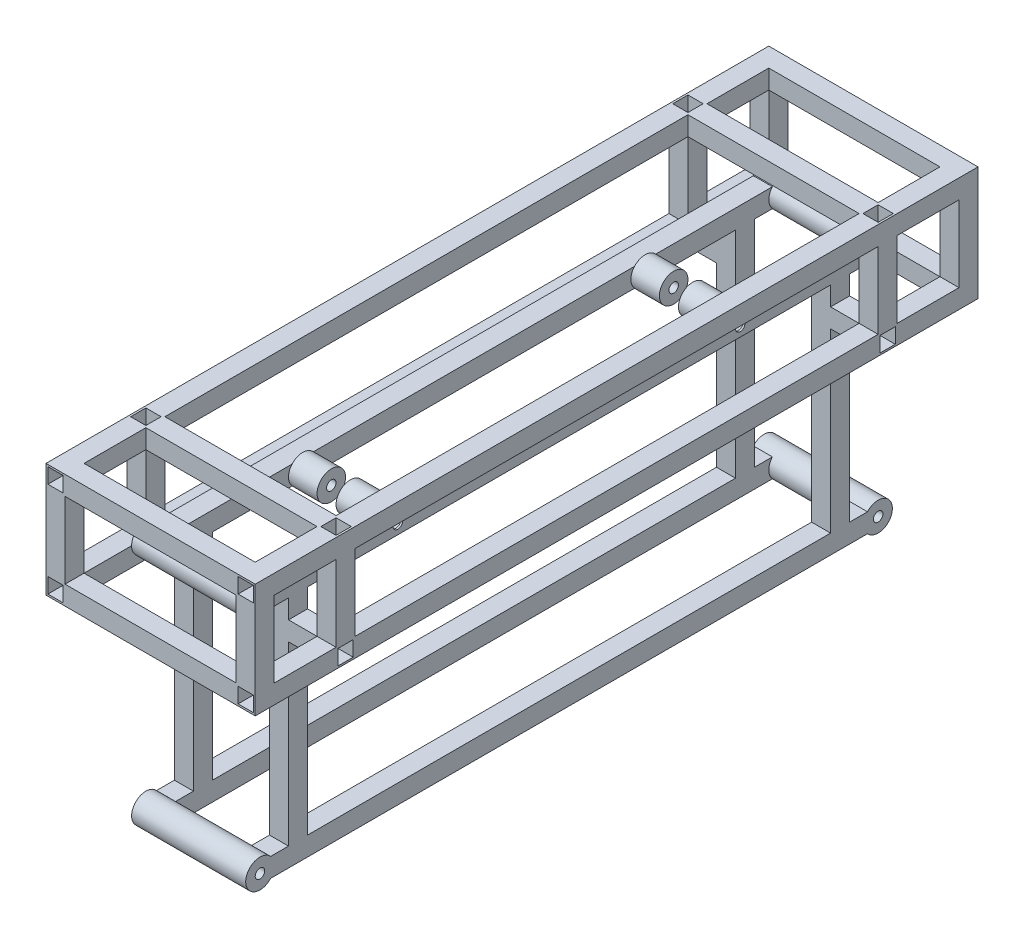
from build123d import *
from build123d.topology import SkipClean

# Parameters (mm, degrees)
SZKIC1_W                      = 20
SZKIC1_H                      = 20
SZKIC1_W_2                    = 16
SZKIC1_H_2                    = 16
DODANIE_WYCI_GNI_CIE1_DEPTH   = 325
DODANIE_WYCI_GNI_CIE1_2_DEPTH = 325
SZKIC3_R                      = 15
DODANIE_WYCI_GNI_CIE2_DEPTH   = 120
SZKIC4_R                      = 5
WYTNIJ_WYCI_GNI_CIE1_DEPTH    = 120
SZKIC5_W                      = 20
SZKIC5_H                      = 20
SZKIC5_W_2                    = 16
SZKIC5_H_2                    = 16
DODANIE_WYCI_GNI_CIE3_DEPTH   = 226
SZKIC6_W                      = 20
SZKIC6_H                      = 20
SZKIC6_W_2                    = 16
SZKIC6_H_2                    = 16
DODANIE_WYCI_GNI_CIE4_DEPTH   = 325
SZKIC7_R                      = 15
DODANIE_WYCI_GNI_CIE5_DEPTH   = 120
SZKIC8_R                      = 5
WYTNIJ_WYCI_GNI_CIE2_DEPTH    = 120
SZKIC15_W                     = 20
SZKIC15_H                     = 20
SZKIC15_W_2                   = 16
SZKIC15_H_2                   = 16
DODANIE_WYCI_GNI_CIE8_DEPTH   = 50
DODANIE_WYCI_GNI_CIE9_REACH   = 679.086
SZKIC16_W                     = 20
SZKIC16_H                     = 20
SZKIC16_W_2                   = 16
SZKIC16_H_2                   = 16
LUSTRO6_COPY_1_SKETCH_W       = 20
LUSTRO6_COPY_1_SKETCH_H       = 20
LUSTRO6_COPY_1_SKETCH_W_2     = 16
LUSTRO6_COPY_1_SKETCH_H_2     = 16
LUSTRO6_COPY_1_DEPTH          = 50
SZKIC17_W                     = 20
SZKIC17_H                     = 20
SZKIC17_W_2                   = 16
SZKIC17_H_2                   = 16
DODANIE_WYCI_GNI_CIE10_DEPTH  = 100
DODANIE_WYCI_GNI_CIE11_REACH  = 711.705
SZKIC19_W                     = 20
SZKIC19_H                     = 20
SZKIC19_W_2                   = 16
SZKIC19_H_2                   = 16
DODANIE_WYCI_GNI_CIE12_REACH  = 507.427
SZKIC20_W                     = 20
SZKIC20_H                     = 20
SZKIC20_W_2                   = 16
SZKIC20_H_2                   = 16
SZKIC22_W                     = 20
SZKIC22_H                     = 20
SZKIC22_W_2                   = 16
SZKIC22_H_2                   = 16
DODANIE_WYCI_GNI_CIE13_DEPTH  = 85
DODANIE_WYCI_GNI_CIE14_REACH  = 535.157
SZKIC23_W                     = 20
SZKIC23_H                     = 20
SZKIC23_W_2                   = 16
SZKIC23_H_2                   = 16
DODANIE_WYCI_GNI_CIE15_REACH  = 518.45
SZKIC24_W                     = 20
SZKIC24_H                     = 20
SZKIC24_W_2                   = 16
SZKIC24_H_2                   = 16
SZKIC25_R                     = 5
WYTNIJ_WYCI_GNI_CIE3_DEPTH    = 120
DODANIE_WYCI_GNI_CIE16_START  = 80
SZKIC26_R                     = 15
SZKIC26_R_2                   = 5
DODANIE_WYCI_GNI_CIE16_DEPTH  = 80
SZKIC11_W                     = 20
SZKIC11_H                     = 300
WYTNIJ_WYCI_GNI_CIE4_DEPTH    = 40
SZKIC14_W                     = 20
SZKIC14_H                     = 300
WYTNIJ_WYCI_GNI_CIE5_DEPTH    = 40


with BuildPart() as part:
    # Szkic1 → Dodanie-wyciągnięcie1 (new, symmetric)
    with BuildSketch(Plane.XY):
        Rectangle(SZKIC1_W, SZKIC1_H)
        Rectangle(SZKIC1_W_2, SZKIC1_H_2, mode=Mode.SUBTRACT)
    extrude(amount=DODANIE_WYCI_GNI_CIE1_DEPTH, both=True)



with BuildPart() as body_2:
    # Szkic1 → Dodanie-wyci_gni_cie1 2 (new, symmetric)
    with BuildSketch(Plane.XY):
        with Locations((-100, 0)):
            Rectangle(SZKIC1_W, SZKIC1_H)
        with Locations((-100, 0)):
            Rectangle(SZKIC1_W_2, SZKIC1_H_2, mode=Mode.SUBTRACT)
    extrude(amount=DODANIE_WYCI_GNI_CIE1_2_DEPTH, both=True)


with BuildPart() as part_1:
    add(part.part)

    add(body_2.part)  # Dodanie-wyciągnięcie2 merges body 2
    # Szkic3 → Dodanie-wyciągnięcie2 (add)
    with BuildSketch(Plane(origin=(10, 0, 0), x_dir=(0, 0, -1), z_dir=(1, 0, 0))):
        with Locations(Location((-325, 0, 0), (0, 0, 41.810314896))):
            Circle(SZKIC3_R)
    dodanie_wyci_gni_cie2 = extrude(amount=-DODANIE_WYCI_GNI_CIE2_DEPTH)

    # Szkic4 → Wytnij-wyciągnięcie1 (cut)
    with BuildSketch(Plane(origin=(10, 0, 0), x_dir=(0, 0, -1), z_dir=(1, 0, 0))):
        with Locations((-325, 0)):
            Circle(SZKIC4_R)
    wytnij_wyci_gni_cie1 = extrude(amount=-WYTNIJ_WYCI_GNI_CIE1_DEPTH, mode=Mode.SUBTRACT)

    # Lustro1: Dodanie-wyciągnięcie2, Wytnij-wyciągnięcie1 across plane
    add(dodanie_wyci_gni_cie2.mirror(Plane.XY))
    add(wytnij_wyci_gni_cie1.mirror(Plane.XY), mode=Mode.SUBTRACT)

    # Szkic5 → Dodanie-wyciągnięcie3 (add)
    # profile 1 of 2: a face of its own
    with BuildSketch(Plane(origin=(0, 10, 0), x_dir=(1, 0, 0), z_dir=(0, 1, 0))):
        with Locations((0, -285)):
            Rectangle(SZKIC5_W, SZKIC5_H)
        with Locations((0, -285)):
            Rectangle(SZKIC5_W_2, SZKIC5_H_2, mode=Mode.SUBTRACT)
    # profile 2 of 2: a face of its own
    with BuildSketch(Plane(origin=(0, 10, 0), x_dir=(1, 0, 0), z_dir=(0, 1, 0))):
        with Locations((-100, -285)):
            Rectangle(SZKIC5_W, SZKIC5_H)
        with Locations((-100, -285)):
            Rectangle(SZKIC5_W_2, SZKIC5_H_2, mode=Mode.SUBTRACT)
    dodanie_wyci_gni_cie3 = extrude(amount=DODANIE_WYCI_GNI_CIE3_DEPTH)

    # Lustro2: Dodanie-wyciągnięcie3 across plane
    add(dodanie_wyci_gni_cie3.mirror(Plane.XY))

    # Szkic6 → Dodanie-wyciągnięcie4 (add, symmetric)
    # profile 1 of 2: a face of its own
    with BuildSketch(Plane.XY):
        with Locations((0, 246)):
            Rectangle(SZKIC6_W, SZKIC6_H)
        with Locations((0, 246)):
            Rectangle(SZKIC6_W_2, SZKIC6_H_2, mode=Mode.SUBTRACT)
    # profile 2 of 2: a face of its own
    with BuildSketch(Plane.XY):
        with Locations((-100, 246)):
            Rectangle(SZKIC6_W, SZKIC6_H)
        with Locations((-100, 246)):
            Rectangle(SZKIC6_W_2, SZKIC6_H_2, mode=Mode.SUBTRACT)
    extrude(amount=DODANIE_WYCI_GNI_CIE4_DEPTH, both=True)

    # Szkic7 → Dodanie-wyciągnięcie5 (add)
    with BuildSketch(Plane(origin=(10, 0, 0), x_dir=(0, 0, -1), z_dir=(1, 0, 0))):
        with Locations(Location((-325, 246, 0), (0, 0, 41.810314896))):
            Circle(SZKIC7_R)
    dodanie_wyci_gni_cie5 = extrude(amount=-DODANIE_WYCI_GNI_CIE5_DEPTH)

    # Szkic8 → Wytnij-wyciągnięcie2 (cut)
    with BuildSketch(Plane(origin=(10, 0, 0), x_dir=(0, 0, -1), z_dir=(1, 0, 0))):
        with Locations((-325, 246)):
            Circle(SZKIC8_R)
    wytnij_wyci_gni_cie2 = extrude(amount=-WYTNIJ_WYCI_GNI_CIE2_DEPTH, mode=Mode.SUBTRACT)

    # Lustro4: Dodanie-wyciągnięcie5, Wytnij-wyciągnięcie2 across plane
    add(dodanie_wyci_gni_cie5.mirror(Plane.XY))
    add(wytnij_wyci_gni_cie2.mirror(Plane.XY), mode=Mode.SUBTRACT)

    # Szkic15 → Dodanie-wyciągnięcie8 (add)
    with BuildSketch(Plane(origin=(10, 0, 0), x_dir=(0, 0, -1), z_dir=(1, 0, 0))):
        with Locations((285, 206)):
            Rectangle(SZKIC15_W, SZKIC15_H)
        with Locations((285, 206)):
            Rectangle(SZKIC15_W_2, SZKIC15_H_2, mode=Mode.SUBTRACT)
    dodanie_wyci_gni_cie8 = extrude(amount=DODANIE_WYCI_GNI_CIE8_DEPTH)

    # Lustro5: Dodanie-wyciągnięcie8 across plane
    add(dodanie_wyci_gni_cie8.mirror(Plane.XY))

    # Szkic16 → Dodanie-wyciągnięcie9 (add, up to next)
    with BuildSketch(Plane.XY.offset(-275), mode=Mode.PRIVATE) as dodanie_wyci_gni_cie9_sk1:
        with Locations((50, 206)):
            Rectangle(SZKIC16_W, SZKIC16_H)
        with Locations((50, 206)):
            Rectangle(SZKIC16_W_2, SZKIC16_H_2, mode=Mode.SUBTRACT)
    dodanie_wyci_gni_cie9_tool1 = extrude(dodanie_wyci_gni_cie9_sk1.sketch, amount=DODANIE_WYCI_GNI_CIE9_REACH, mode=Mode.PRIVATE) - part_1.part
    dodanie_wyci_gni_cie9 = dodanie_wyci_gni_cie9_tool1.solids().sort_by_distance((50, 215.717157, -275))[0]
    add(dodanie_wyci_gni_cie9)

    # Lustro6: Dodanie-wyciągnięcie8, Dodanie-wyciągnięcie9 across plane
    add(dodanie_wyci_gni_cie8.mirror(Plane(origin=(-50, 0, 0), x_dir=(0, 0, 1), z_dir=(1, 0, 0))))
    add(dodanie_wyci_gni_cie9.mirror(Plane(origin=(-50, 0, 0), x_dir=(0, 0, 1), z_dir=(1, 0, 0))))

    # Lustro6 copy 1 sketch → Lustro6 copy 1 (add)
    with BuildSketch(Plane.ZY.offset(110)):
        with Locations((285, 206)):
            Rectangle(LUSTRO6_COPY_1_SKETCH_W, LUSTRO6_COPY_1_SKETCH_H)
        with Locations((285, 206)):
            Rectangle(LUSTRO6_COPY_1_SKETCH_W_2, LUSTRO6_COPY_1_SKETCH_H_2, mode=Mode.SUBTRACT)
    extrude(amount=LUSTRO6_COPY_1_DEPTH)

    # Szkic17 → Dodanie-wyciągnięcie10 (add)
    # profile 1 of 4: a face of its own
    with BuildSketch(Plane(origin=(0, 216, 0), x_dir=(1, 0, 0), z_dir=(0, 1, 0))):
        with Locations((50, 285)):
            Rectangle(SZKIC17_W, SZKIC17_H)
        with Locations((50, 285)):
            Rectangle(SZKIC17_W_2, SZKIC17_H_2, mode=Mode.SUBTRACT)
    # profile 2 of 4: a face of its own
    with BuildSketch(Plane(origin=(0, 216, 0), x_dir=(1, 0, 0), z_dir=(0, 1, 0))):
        with Locations((50, -285)):
            Rectangle(SZKIC17_W, SZKIC17_H)
        with Locations((50, -285)):
            Rectangle(SZKIC17_W_2, SZKIC17_H_2, mode=Mode.SUBTRACT)
    # profile 3 of 4: a face of its own
    with BuildSketch(Plane(origin=(0, 216, 0), x_dir=(1, 0, 0), z_dir=(0, 1, 0))):
        with Locations((-150, 285)):
            Rectangle(SZKIC17_W, SZKIC17_H)
        with Locations((-150, 285)):
            Rectangle(SZKIC17_W_2, SZKIC17_H_2, mode=Mode.SUBTRACT)
    # profile 4 of 4: a face of its own
    with BuildSketch(Plane(origin=(0, 216, 0), x_dir=(1, 0, 0), z_dir=(0, 1, 0))):
        with Locations((-150, -285)):
            Rectangle(SZKIC17_W, SZKIC17_H)
        with Locations((-150, -285)):
            Rectangle(SZKIC17_W_2, SZKIC17_H_2, mode=Mode.SUBTRACT)
    extrude(amount=DODANIE_WYCI_GNI_CIE10_DEPTH)

    # Szkic19 → Dodanie-wyciągnięcie11 (add, up to next)
    with BuildSketch(Plane(origin=(0, 0, 275), x_dir=(-1, 0, 0), z_dir=(0, 0, -1)), mode=Mode.PRIVATE) as dodanie_wyci_gni_cie11_sk1:
        with Locations((150, 306)):
            Rectangle(SZKIC19_W, SZKIC19_H)
        with Locations((150, 306)):
            Rectangle(SZKIC19_W_2, SZKIC19_H_2, mode=Mode.SUBTRACT)
    dodanie_wyci_gni_cie11_tool1 = extrude(dodanie_wyci_gni_cie11_sk1.sketch, amount=DODANIE_WYCI_GNI_CIE11_REACH, mode=Mode.PRIVATE) - part_1.part
    dodanie_wyci_gni_cie11 = dodanie_wyci_gni_cie11_tool1.solids().sort_by_distance((-150, 315.717157, 275))[0]
    add(dodanie_wyci_gni_cie11)

    # Lustro7: Dodanie-wyciągnięcie11 across plane
    add(dodanie_wyci_gni_cie11.mirror(Plane(origin=(-50, 0, 0), x_dir=(0, 0, 1), z_dir=(1, 0, 0))))

    # Szkic20 → Dodanie-wyciągnięcie12 (add, up to next)
    with BuildSketch(Plane(origin=(-140, 0, 0), x_dir=(0, 0, -1), z_dir=(1, 0, 0)), mode=Mode.PRIVATE) as dodanie_wyci_gni_cie12_sk1:
        with Locations((285, 306)):
            Rectangle(SZKIC20_W, SZKIC20_H)
        with Locations((285, 306)):
            Rectangle(SZKIC20_W_2, SZKIC20_H_2, mode=Mode.SUBTRACT)
    dodanie_wyci_gni_cie12_tool1 = extrude(dodanie_wyci_gni_cie12_sk1.sketch, amount=DODANIE_WYCI_GNI_CIE12_REACH, mode=Mode.PRIVATE) - part_1.part
    dodanie_wyci_gni_cie12 = dodanie_wyci_gni_cie12_tool1.solids().sort_by_distance((-140, 315.717157, -285))[0]
    add(dodanie_wyci_gni_cie12)

    # Lustro8: Dodanie-wyciągnięcie12 across plane
    add(dodanie_wyci_gni_cie12.mirror(Plane.XY))

    # Szkic22 → Dodanie-wyciągnięcie13 (add)
    # profile 1 of 4: a face of its own
    with BuildSketch(Plane(origin=(0, 0, -295), x_dir=(-1, 0, 0), z_dir=(0, 0, -1))):
        with Locations((150, 306)):
            Rectangle(SZKIC22_W, SZKIC22_H)
        with Locations((150, 306)):
            Rectangle(SZKIC22_W_2, SZKIC22_H_2, mode=Mode.SUBTRACT)
    # profile 2 of 4: a face of its own
    with BuildSketch(Plane(origin=(0, 0, -295), x_dir=(-1, 0, 0), z_dir=(0, 0, -1))):
        with Locations((150, 206)):
            Rectangle(SZKIC22_W, SZKIC22_H)
        with Locations((150, 206)):
            Rectangle(SZKIC22_W_2, SZKIC22_H_2, mode=Mode.SUBTRACT)
    # profile 3 of 4: a face of its own
    with BuildSketch(Plane(origin=(0, 0, -295), x_dir=(-1, 0, 0), z_dir=(0, 0, -1))):
        with Locations((-50, 206)):
            Rectangle(SZKIC22_W, SZKIC22_H)
        with Locations((-50, 206)):
            Rectangle(SZKIC22_W_2, SZKIC22_H_2, mode=Mode.SUBTRACT)
    # profile 4 of 4: a face of its own
    with BuildSketch(Plane(origin=(0, 0, -295), x_dir=(-1, 0, 0), z_dir=(0, 0, -1))):
        with Locations((-50, 306)):
            Rectangle(SZKIC22_W, SZKIC22_H)
        with Locations((-50, 306)):
            Rectangle(SZKIC22_W_2, SZKIC22_H_2, mode=Mode.SUBTRACT)
    dodanie_wyci_gni_cie13 = extrude(amount=DODANIE_WYCI_GNI_CIE13_DEPTH)

    # Szkic23 → Dodanie-wyciągnięcie14 (add, up to next)
    with BuildSketch(Plane.ZY.offset(-40), mode=Mode.PRIVATE) as dodanie_wyci_gni_cie14_sk1:
        with Locations((-370, 206)):
            Rectangle(SZKIC23_W, SZKIC23_H)
        with Locations((-370, 206)):
            Rectangle(SZKIC23_W_2, SZKIC23_H_2, mode=Mode.SUBTRACT)
    dodanie_wyci_gni_cie14_tool1 = extrude(dodanie_wyci_gni_cie14_sk1.sketch, amount=DODANIE_WYCI_GNI_CIE14_REACH, mode=Mode.PRIVATE) - part_1.part
    # Szkic23 → Dodanie-wyciągnięcie14 (add, up to next)
    with BuildSketch(Plane.ZY.offset(-40), mode=Mode.PRIVATE) as dodanie_wyci_gni_cie14_sk2:
        with Locations((-370, 306)):
            Rectangle(SZKIC23_W, SZKIC23_H)
        with Locations((-370, 306)):
            Rectangle(SZKIC23_W_2, SZKIC23_H_2, mode=Mode.SUBTRACT)
    dodanie_wyci_gni_cie14_tool2 = extrude(dodanie_wyci_gni_cie14_sk2.sketch, amount=DODANIE_WYCI_GNI_CIE14_REACH, mode=Mode.PRIVATE) - part_1.part
    dodanie_wyci_gni_cie14_1 = dodanie_wyci_gni_cie14_tool1.solids().sort_by_distance((40, 215.717157, -370))[0]
    add(dodanie_wyci_gni_cie14_1)
    dodanie_wyci_gni_cie14_2 = dodanie_wyci_gni_cie14_tool2.solids().sort_by_distance((40, 315.717157, -370))[0]
    add(dodanie_wyci_gni_cie14_2)
    dodanie_wyci_gni_cie14 = dodanie_wyci_gni_cie14_1 + dodanie_wyci_gni_cie14_2  # Dodanie-wyciągnięcie14 as one shape, for the pattern or mirror that repeats it

    # Szkic24 → Dodanie-wyciągnięcie15 (add, up to next)
    with BuildSketch(Plane.XZ.offset(-296), mode=Mode.PRIVATE) as dodanie_wyci_gni_cie15_sk1:
        with Locations((-150, -370)):
            Rectangle(SZKIC24_W, SZKIC24_H)
        with Locations((-150, -370)):
            Rectangle(SZKIC24_W_2, SZKIC24_H_2, mode=Mode.SUBTRACT)
    dodanie_wyci_gni_cie15_tool1 = extrude(dodanie_wyci_gni_cie15_sk1.sketch, amount=DODANIE_WYCI_GNI_CIE15_REACH, mode=Mode.PRIVATE) - part_1.part
    # Szkic24 → Dodanie-wyciągnięcie15 (add, up to next)
    with BuildSketch(Plane.XZ.offset(-296), mode=Mode.PRIVATE) as dodanie_wyci_gni_cie15_sk2:
        with Locations((50, -370)):
            Rectangle(SZKIC24_W, SZKIC24_H)
        with Locations((50, -370)):
            Rectangle(SZKIC24_W_2, SZKIC24_H_2, mode=Mode.SUBTRACT)
    dodanie_wyci_gni_cie15_tool2 = extrude(dodanie_wyci_gni_cie15_sk2.sketch, amount=DODANIE_WYCI_GNI_CIE15_REACH, mode=Mode.PRIVATE) - part_1.part
    dodanie_wyci_gni_cie15_1 = dodanie_wyci_gni_cie15_tool1.solids().sort_by_distance((-150, 296, -379.717157))[0]
    add(dodanie_wyci_gni_cie15_1)
    dodanie_wyci_gni_cie15_2 = dodanie_wyci_gni_cie15_tool2.solids().sort_by_distance((50, 296, -379.717157))[0]
    add(dodanie_wyci_gni_cie15_2)
    dodanie_wyci_gni_cie15 = dodanie_wyci_gni_cie15_1 + dodanie_wyci_gni_cie15_2  # Dodanie-wyciągnięcie15 as one shape, for the pattern or mirror that repeats it

    # Lustro9: Dodanie-wyciągnięcie13, Dodanie-wyciągnięcie14, Dodanie-wyciągnięcie15 across plane
    add(dodanie_wyci_gni_cie13.mirror(Plane.XY))
    add(dodanie_wyci_gni_cie14.mirror(Plane.XY))
    add(dodanie_wyci_gni_cie15.mirror(Plane.XY))

    # Szkic25 → Wytnij-wyciągnięcie3 (cut)
    with BuildSketch(Plane(origin=(10, 0, 0), x_dir=(0, 0, -1), z_dir=(1, 0, 0))):
        with Locations((-180, 246)):
            Circle(SZKIC25_R)
    wytnij_wyci_gni_cie3 = extrude(amount=-WYTNIJ_WYCI_GNI_CIE3_DEPTH, mode=Mode.SUBTRACT)

    # Lustro10: Wytnij-wyciągnięcie3 across plane
    add(wytnij_wyci_gni_cie3.mirror(Plane.XY), mode=Mode.SUBTRACT)

    # Szkic26 → Dodanie-wyciągnięcie16 (add)
    with BuildSketch(Plane(origin=(-90, 0, 0), x_dir=(0, 0, -1), z_dir=(1, 0, 0)).offset(DODANIE_WYCI_GNI_CIE16_START)):
        with Locations(Location((180, 246, 0), (0, 0, 221.810314896))):
            Circle(SZKIC26_R)
        with Locations((180, 246)):
            Circle(SZKIC26_R_2, mode=Mode.SUBTRACT)
    dodanie_wyci_gni_cie16 = extrude(amount=-DODANIE_WYCI_GNI_CIE16_DEPTH)

    # Lustro11: Dodanie-wyciągnięcie16 across plane
    with SkipClean():  # the faces are left unmerged after this step: merging them gives an invalid solid
        add(dodanie_wyci_gni_cie16.mirror(Plane.XY))
    add(part_1.part.scale(1), mode=Mode.REPLACE)  # the faces are merged on a copy

    # Szkic11 → Wytnij-wyciągnięcie4 (cut, symmetric)
    with SkipClean():  # the faces are left unmerged after this step: merging them gives an invalid solid
        with BuildSketch(Plane(origin=(0, 256, 0), x_dir=(1, 0, 0), z_dir=(0, 1, 0))):
            with Locations((-50, -150)):
                Rectangle(SZKIC11_W, SZKIC11_H)
        extrude(amount=WYTNIJ_WYCI_GNI_CIE4_DEPTH, both=True, mode=Mode.SUBTRACT)

    # Szkic14 → Wytnij-wyciągnięcie5 (cut, symmetric)
    with BuildSketch(Plane(origin=(0, 256, 0), x_dir=(1, 0, 0), z_dir=(0, 1, 0))):
        with Locations((-50, 150)):
            Rectangle(SZKIC14_W, SZKIC14_H)
    extrude(amount=WYTNIJ_WYCI_GNI_CIE5_DEPTH, both=True, mode=Mode.SUBTRACT)


solid = part_1.part
